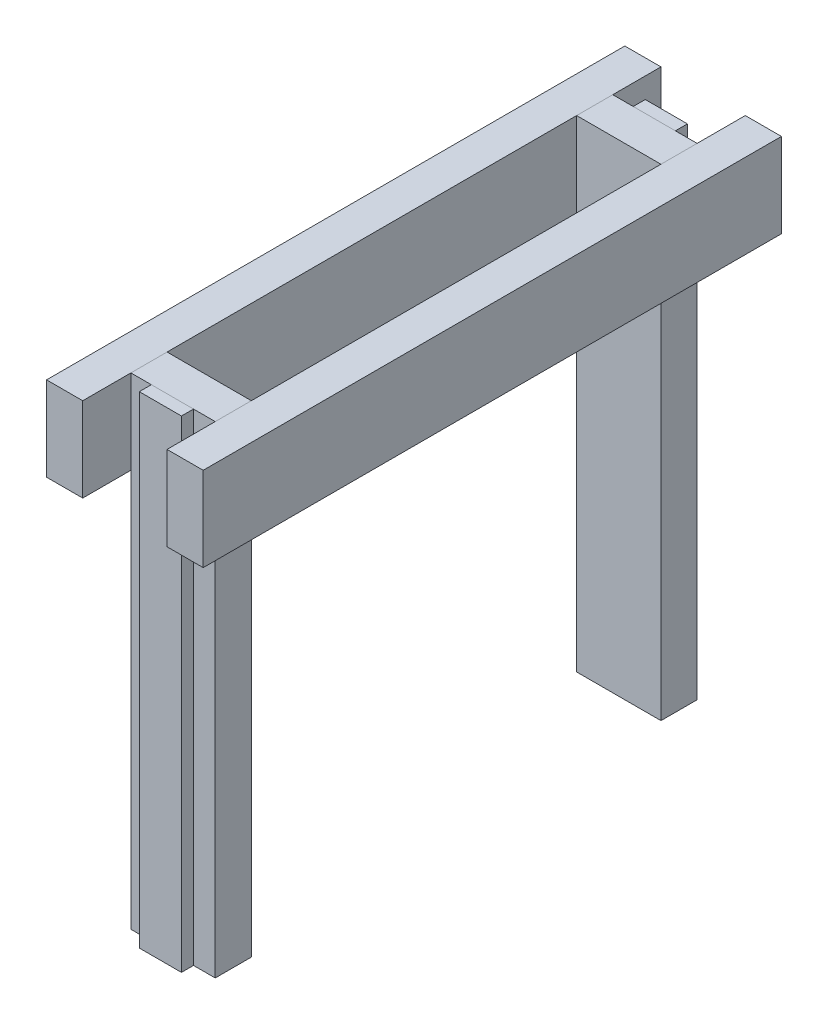
from build123d import *

# Parameters (mm, degrees)
SKETCH3_W            = 88.9
SKETCH3_H            = 38.1
VERTICAL_BOARD_DEPTH = 508
SKETCH6_W            = 609.6
SKETCH6_H            = 88.9
LATERAL_BOARD_DEPTH  = 38.1
SKETCH7_W            = 44.45
SKETCH7_H            = 508
DRAWER_SLIDE_DEPTH   = 12.7


with BuildPart() as part:
    # Sketch3 → Vertical Board (new body)
    with BuildSketch(Plane(origin=(0, 0, 0), x_dir=(1, 0, 0), z_dir=(0, 1, 0))):
        with Locations((0, -234.95)):
            Rectangle(SKETCH3_W, SKETCH3_H)
    extrude(amount=-VERTICAL_BOARD_DEPTH)


with BuildPart() as body_2:
    # Vertical Board Mirror: mirrored copy
    add(part.part.mirror(Plane.XY))


with BuildPart() as body_3:
    # Sketch6 → Lateral Board (new body)
    with BuildSketch(Plane(origin=(44.45, 0, 0), x_dir=(0, 0, -1), z_dir=(1, 0, 0))):
        with Locations((0, -44.45)):
            Rectangle(SKETCH6_W, SKETCH6_H)
    extrude(amount=LATERAL_BOARD_DEPTH)


with BuildPart() as body_4:
    # Lateral Board Mirror: mirrored copy
    add(body_3.part.mirror(Plane(origin=(0, 0, 0), x_dir=(0, 0, 1), z_dir=(1, 0, 0))))


with BuildPart() as body_5:
    # Sketch7 → Drawer Slide (new body)
    with BuildSketch(Plane.XY.offset(254)):
        with Locations((-0.675755403, -254)):
            Rectangle(SKETCH7_W, SKETCH7_H)
    extrude(amount=DRAWER_SLIDE_DEPTH)


with BuildPart() as body_6:
    # Drawer Slide Mirror: mirrored copy
    add(body_5.part.mirror(Plane.XY))


solid = Compound([part.part, body_2.part, body_3.part, body_4.part, body_5.part, body_6.part])
